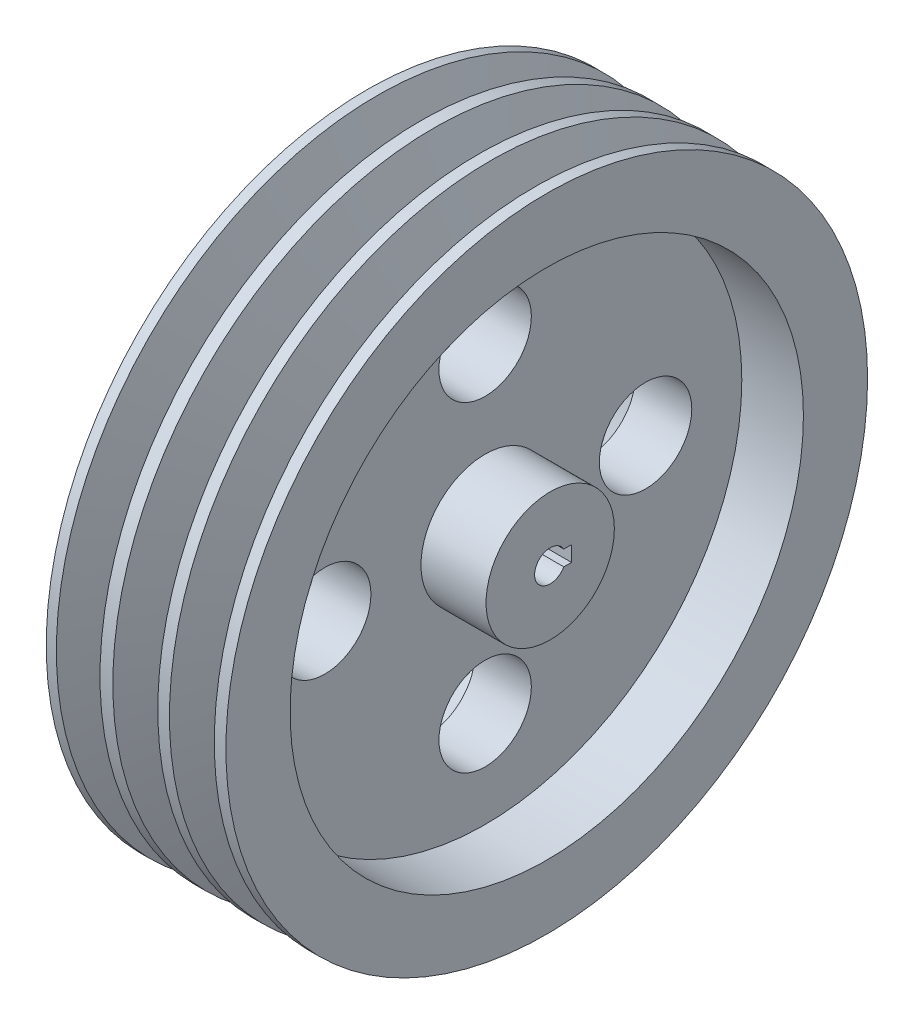
from build123d import *

# Parameters (mm, degrees)
SKETCH4_R          = 18
CUT_EXTRUDE2_DEPTH = 191.632264763


with BuildPart() as part:
    # Sketch1 → Revolve2 (revolve)
    with BuildSketch(Plane(origin=(0, 0, 0), x_dir=(1, 0, 0), z_dir=(0, 1, 0))):
        Polygon((0, 6.083202512), (70, 6.083202512), (70, 25), (44.651136178, 25), (44.651136178, 100), (68.651136178, 100), (68.651136178, 125), (64.121995326, 125), (57.455679022, 107), (53.089915226, 107), (46.652833964, 125), (42.111811271, 125), (36.118360649, 107), (31.722806927, 107), (24.601983551, 125), (19.601983551, 125), (12.850084898, 107), (8.95007039, 107), (2.597616176, 125), (-1.348863822, 125), (-1.348863822, 100), (22.651136178, 100), (22.651136178, 25), (0, 25), align=None)
    revolve(axis=Axis((70, 0, 0), (-1, 0, 0)))

    # Sketch4 → Cut-Extrude2 (cut, through all)
    with BuildSketch(Plane(origin=(70, 0, 0), x_dir=(0, 0, -1), z_dir=(1, 0, 0))):
        with BuildLine():
            Line((5.29200839, -3), (8.29200839, -3))
            Line((8.29200839, -3), (8.29200839, 3))
            Line((8.29200839, 3), (5.29200839, 3))
            ThreePointArc((5.29200839, 3), (6.083202512, 0), (5.29200839, -3))
        make_face()
        with Locations((62.5, 0)):
            Circle(SKETCH4_R)
        with Locations((0, 62.5)):
            Circle(SKETCH4_R)
        with Locations((0, -62.5)):
            Circle(SKETCH4_R)
        with Locations((-62.5, 0)):
            Circle(SKETCH4_R)
    extrude(amount=-CUT_EXTRUDE2_DEPTH, mode=Mode.SUBTRACT)


solid = part.part
